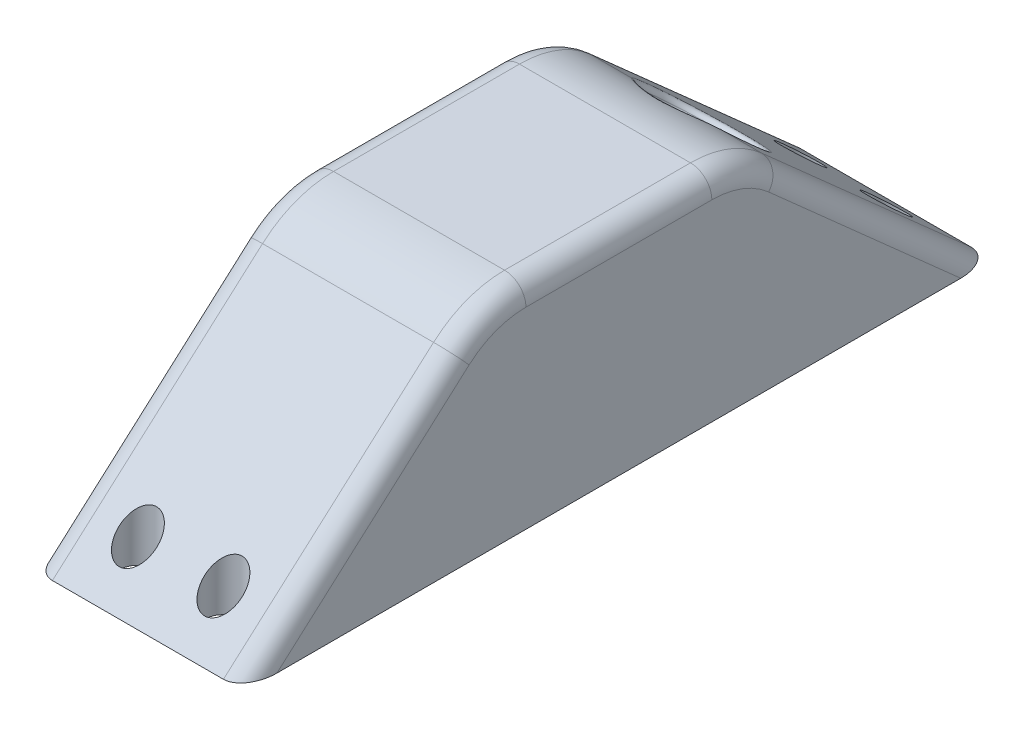
from build123d import *

# Parameters (mm, degrees)
BOSS_EXTRUDE1_DEPTH = 20
FILLET1_R           = 2
SKETCH3_W           = 14.1
SKETCH3_H           = 19.5
CUT_EXTRUDE1_DEPTH  = 34
SKETCH4_R           = 4.75
CUT_EXTRUDE2_DEPTH  = 20
SKETCH4_5_W         = 11.9
SKETCH4_5_H         = 11.8
SKETCH4_5_R         = 4.75
CUT_EXTRUDE3_DEPTH  = 11
SKETCH4_6_W         = 14.1
SKETCH4_6_H         = 13
SKETCH4_6_W_2       = 11.9
SKETCH4_6_H_2       = 11.8
CUT_EXTRUDE4_DEPTH  = 5.3
SKETCH4_8_W         = 14.1
SKETCH4_8_H         = 17
CUT_EXTRUDE5_DEPTH  = 2
FILLET2_R           = 0.5
SKETCH7_R           = 1.75
CUT_EXTRUDE7_DEPTH  = 15


with BuildPart() as part:
    # Sketch2 → Boss-Extrude1 (new body)
    with BuildSketch(Plane(origin=(0, 0, 0), x_dir=(0, 0, -1), z_dir=(1, 0, 0))):
        with BuildLine():
            Line((-35, 0), (35, 0))
            Line((35, 0), (15.341645165, 17.474093187))
            ThreePointArc((15.341645165, 17.474093187), (12.251812352, 19.347217015), (8.698006777, 20))
            Line((8.698006777, 20), (-8.698006777, 20))
            ThreePointArc((-8.698006777, 20), (-12.251812352, 19.347217015), (-15.341645165, 17.474093187))
            Line((-15.341645165, 17.474093187), (-35, 0))
        make_face()
    extrude(amount=BOSS_EXTRUDE1_DEPTH)

    # Fillet1
    fillet1_edges = [part.edges().sort_by_distance(p)[0] for p in [
        (20, 8.737046593, -25.170822582),
        (20, 19.347217015, -12.251812352),
        (20, 8.737046593, 25.170822582),
        (20, 19.347217015, 12.251812352),
        (20, 20, 0),
        (0, 8.737046593, -25.170822582),
        (0, 19.347217015, -12.251812352),
        (0, 20, 0),
        (0, 19.347217015, 12.251812352),
        (0, 8.737046593, 25.170822582),
    ]]
    fillet(fillet1_edges, radius=FILLET1_R)

    # Sketch3 → Cut-Extrude1 (cut)
    with BuildSketch(Plane(origin=(0, -17.379310345, -19.551724138), x_dir=(-1, 0, 0), z_dir=(0, -0.6643638388299198, -0.7474093186836597))):
        with Locations((-10, 0.502734359)):
            Rectangle(SKETCH3_W, SKETCH3_H)
    extrude(amount=-CUT_EXTRUDE1_DEPTH, mode=Mode.SUBTRACT)

    # Sketch4 → Cut-Extrude2 (cut)
    with BuildSketch(Plane(origin=(0, 7.662989202, -6.811545957), x_dir=(1, 0, 0), z_dir=(0, -0.7474093186836597, 0.6643638388299198))):
        with Locations((10, -3.034326154)):
            Circle(SKETCH4_R)
    extrude(amount=-CUT_EXTRUDE2_DEPTH, mode=Mode.SUBTRACT)

    # Sketch4<5> → Cut-Extrude3 (cut)
    with BuildSketch(Plane(origin=(0, 7.662989202, -6.811545957), x_dir=(1, 0, 0), z_dir=(0, -0.7474093186836597, 0.6643638388299198))):
        with Locations((10, -3.034326154)):
            Rectangle(SKETCH4_5_W, SKETCH4_5_H)
        with Locations((10, -3.034326154)):
            Circle(SKETCH4_5_R, mode=Mode.SUBTRACT)
    extrude(amount=-CUT_EXTRUDE3_DEPTH, mode=Mode.SUBTRACT)

    # Sketch4<6> → Cut-Extrude4 (cut)
    with BuildSketch(Plane(origin=(0, 7.662989202, -6.811545957), x_dir=(1, 0, 0), z_dir=(0, -0.7474093186836597, 0.6643638388299198))):
        with Locations((10, -3.034326154)):
            Rectangle(SKETCH4_6_W, SKETCH4_6_H)
        with Locations((10, -3.034326154)):
            Rectangle(SKETCH4_6_W_2, SKETCH4_6_H_2, mode=Mode.SUBTRACT)
    extrude(amount=-CUT_EXTRUDE4_DEPTH, mode=Mode.SUBTRACT)

    # Sketch4<8> → Cut-Extrude5 (cut)
    with BuildSketch(Plane(origin=(0, 7.662989202, -6.811545957), x_dir=(1, 0, 0), z_dir=(0, -0.7474093186836597, 0.6643638388299198))):
        with Locations((10, -3.034326154)):
            Rectangle(SKETCH4_8_W, SKETCH4_8_H)
    extrude(amount=-CUT_EXTRUDE5_DEPTH, mode=Mode.SUBTRACT)

    # Fillet2
    fillet2_edges = [part.edges().sort_by_distance(p)[0] for p in [
        (8.298617151, 12.417067152, -21.030799454),
        (10, 18.426095202, -14.08325697),
    ]]
    fillet(fillet2_edges, radius=FILLET2_R)

    # Sketch7 → Cut-Extrude7 (cut)
    with BuildSketch(Plane(origin=(0, 10, 0), x_dir=(1, 0, 0), z_dir=(0, 1, 0))):
        with Locations((14, 31)):
            Circle(SKETCH7_R)
        with Locations((6, 31)):
            Circle(SKETCH7_R)
        with Locations((14, -31)):
            Circle(SKETCH7_R)
        with Locations((6, -31)):
            Circle(SKETCH7_R)
    extrude(amount=-CUT_EXTRUDE7_DEPTH, mode=Mode.SUBTRACT)


solid = part.part
